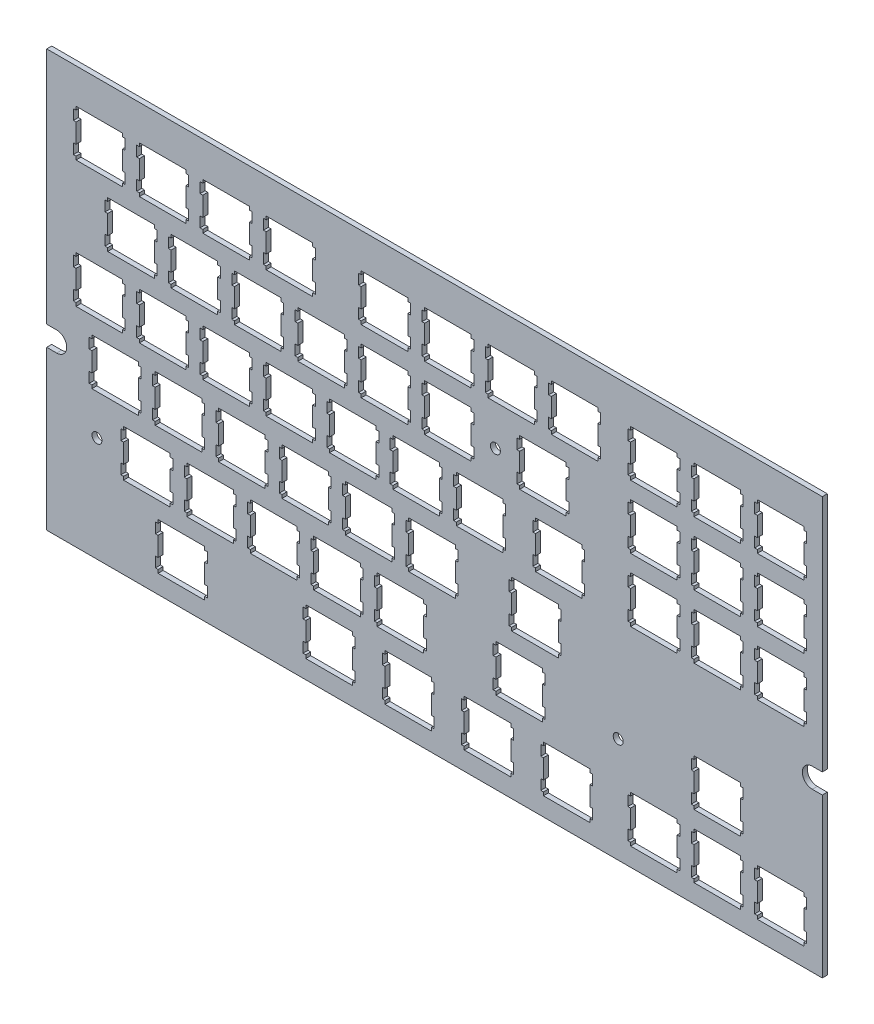
from build123d import *

# Parameters (mm, degrees)
MODEL_R         = 1.5
EXTRUDE_1_DEPTH = 1.5


with BuildPart() as part:
    # Model → 凸台-拉伸1 (new body)
    with BuildSketch(Plane.XY):
        with BuildLine():
            Line((633.499559269, 183.569871673), (633.499559269, 111.895271673))
            Line((633.499559269, 111.895271673), (630.499559269, 111.895271673))
            ThreePointArc((630.499559269, 111.895271673), (627.499559269, 108.895271673), (630.499559269, 105.895271673))
            Line((630.499559269, 105.895271673), (633.499559269, 105.895271673))
            Line((633.499559269, 105.895271673), (633.499559269, 58.269564673))
            Line((633.499559269, 58.269564673), (400.385559269, 58.269564673))
            Line((400.385559269, 58.269564673), (400.385559269, 105.895271673))
            Line((400.385559269, 105.895271673), (403.385559269, 105.895271673))
            ThreePointArc((403.385559269, 105.895271673), (406.385559269, 108.895271673), (403.385559269, 111.895271673))
            Line((403.385559269, 111.895271673), (400.385559269, 111.895271673))
            Line((400.385559269, 111.895271673), (400.385559269, 183.569871673))
            Line((400.385559269, 183.569871673), (633.499559269, 183.569871673))
        make_face()
        with Locations((415.473559269, 89.845571673)):
            Circle(MODEL_R, mode=Mode.SUBTRACT)
        with Locations((535.248446769, 146.995271673)):
            Circle(MODEL_R, mode=Mode.SUBTRACT)
        with Locations((572.157446769, 89.845546673)):
            Circle(MODEL_R, mode=Mode.SUBTRACT)
        Polygon((613.973559269, 77.796371673), (613.973559269, 76.795971673), (613.172559269, 76.795971673), (613.172559269, 73.696671673), (613.973559269, 73.696671673), (613.973559269, 67.895161673), (613.172559269, 67.895161673), (613.172559269, 64.795981673), (613.973559269, 64.795981673), (613.973559269, 63.795511673), (627.973559269, 63.795511673), (627.973559269, 64.795981673), (628.772559269, 64.795981673), (628.772559269, 67.895161673), (627.973559269, 67.895161673), (627.973559269, 73.696671673), (628.772559269, 73.696671673), (628.772559269, 76.795971673), (627.973559269, 76.795971673), (627.973559269, 77.796371673), align=None, mode=Mode.SUBTRACT)
        Polygon((594.923559269, 77.796371673), (594.923559269, 76.795971673), (594.122559269, 76.795971673), (594.122559269, 73.696671673), (594.923559269, 73.696671673), (594.923559269, 67.895161673), (594.122559269, 67.895161673), (594.122559269, 64.795981673), (594.923559269, 64.795981673), (594.923559269, 63.795511673), (608.923559269, 63.795511673), (608.923559269, 64.795981673), (609.722559269, 64.795981673), (609.722559269, 67.895161673), (608.923559269, 67.895161673), (608.923559269, 73.696671673), (609.722559269, 73.696671673), (609.722559269, 76.795971673), (608.923559269, 76.795971673), (608.923559269, 77.796371673), align=None, mode=Mode.SUBTRACT)
        Polygon((575.873559269, 77.796371673), (575.873559269, 76.795971673), (575.072559269, 76.795971673), (575.072559269, 73.696671673), (575.873559269, 73.696671673), (575.873559269, 67.895161673), (575.072559269, 67.895161673), (575.072559269, 64.795981673), (575.873559269, 64.795981673), (575.873559269, 63.795511673), (589.873559269, 63.795511673), (589.873559269, 64.795981673), (590.672559269, 64.795981673), (590.672559269, 67.895161673), (589.873559269, 67.895161673), (589.873559269, 73.696671673), (590.672559269, 73.696671673), (590.672559269, 76.795971673), (589.873559269, 76.795971673), (589.873559269, 77.796371673), align=None, mode=Mode.SUBTRACT)
        Polygon((549.678559269, 77.796371673), (549.678559269, 76.795971673), (548.879559269, 76.795971673), (548.879559269, 73.696671673), (549.678559269, 73.696671673), (549.678559269, 67.895161673), (548.879559269, 67.895161673), (548.879559269, 64.795981673), (549.678559269, 64.795981673), (549.678559269, 63.795511673), (563.679559269, 63.795511673), (563.679559269, 64.795981673), (564.478559269, 64.795981673), (564.478559269, 67.895161673), (563.679559269, 67.895161673), (563.679559269, 73.696671673), (564.478559269, 73.696671673), (564.478559269, 76.795971673), (563.679559269, 76.795971673), (563.679559269, 77.796371673), align=None, mode=Mode.SUBTRACT)
        Polygon((525.867559269, 77.796371673), (525.867559269, 76.795971673), (525.066559269, 76.795971673), (525.066559269, 73.696671673), (525.867559269, 73.696671673), (525.867559269, 67.895161673), (525.066559269, 67.895161673), (525.066559269, 64.795981673), (525.867559269, 64.795981673), (525.867559269, 63.795511673), (539.866559269, 63.795511673), (539.866559269, 64.795981673), (540.667559269, 64.795981673), (540.667559269, 67.895161673), (539.866559269, 67.895161673), (539.866559269, 73.696671673), (540.667559269, 73.696671673), (540.667559269, 76.795971673), (539.866559269, 76.795971673), (539.866559269, 77.796371673), align=None, mode=Mode.SUBTRACT)
        Polygon((502.053559269, 77.796371673), (502.053559269, 76.795971673), (501.254559269, 76.795971673), (501.254559269, 73.696671673), (502.053559269, 73.696671673), (502.053559269, 67.895161673), (501.254559269, 67.895161673), (501.254559269, 64.795981673), (502.053559269, 64.795981673), (502.053559269, 63.795511673), (516.054559269, 63.795511673), (516.054559269, 64.795981673), (516.853559269, 64.795981673), (516.853559269, 67.895161673), (516.054559269, 67.895161673), (516.054559269, 73.696671673), (516.853559269, 73.696671673), (516.853559269, 76.795971673), (516.054559269, 76.795971673), (516.054559269, 77.796371673), align=None, mode=Mode.SUBTRACT)
        Polygon((478.242559269, 77.796371673), (478.242559269, 76.795971673), (477.441559269, 76.795971673), (477.441559269, 73.696671673), (478.242559269, 73.696671673), (478.242559269, 67.895161673), (477.441559269, 67.895161673), (477.441559269, 64.795981673), (478.242559269, 64.795981673), (478.242559269, 63.795511673), (492.241559269, 63.795511673), (492.241559269, 64.795981673), (493.042559269, 64.795981673), (493.042559269, 67.895161673), (492.241559269, 67.895161673), (492.241559269, 73.696671673), (493.042559269, 73.696671673), (493.042559269, 76.795971673), (492.241559269, 76.795971673), (492.241559269, 77.796371673), align=None, mode=Mode.SUBTRACT)
        Polygon((594.923559269, 96.844871673), (594.923559269, 95.844571673), (594.122559269, 95.844571673), (594.122559269, 92.746671673), (594.923559269, 92.746671673), (594.923559269, 86.945171673), (594.122559269, 86.945171673), (594.122559269, 83.844571673), (594.923559269, 83.844571673), (594.923559269, 82.845471673), (608.923559269, 82.845471673), (608.923559269, 83.844571673), (609.722559269, 83.844571673), (609.722559269, 86.945171673), (608.923559269, 86.945171673), (608.923559269, 92.746671673), (609.722559269, 92.746671673), (609.722559269, 95.844571673), (608.923559269, 95.844571673), (608.923559269, 96.844871673), align=None, mode=Mode.SUBTRACT)
        Polygon((499.673559269, 96.844871673), (499.673559269, 95.844571673), (498.872559269, 95.844571673), (498.872559269, 92.746671673), (499.673559269, 92.746671673), (499.673559269, 86.945171673), (498.872559269, 86.945171673), (498.872559269, 83.844571673), (499.673559269, 83.844571673), (499.673559269, 82.845471673), (513.673559269, 82.845471673), (513.673559269, 83.844571673), (514.472559269, 83.844571673), (514.472559269, 86.945171673), (513.673559269, 86.945171673), (513.673559269, 92.746671673), (514.472559269, 92.746671673), (514.472559269, 95.844571673), (513.673559269, 95.844571673), (513.673559269, 96.844871673), align=None, mode=Mode.SUBTRACT)
        Polygon((480.623559269, 96.844871673), (480.623559269, 95.844571673), (479.822559269, 95.844571673), (479.822559269, 92.746671673), (480.623559269, 92.746671673), (480.623559269, 86.945171673), (479.822559269, 86.945171673), (479.822559269, 83.844571673), (480.623559269, 83.844571673), (480.623559269, 82.845471673), (494.623559269, 82.845471673), (494.623559269, 83.844571673), (495.422559269, 83.844571673), (495.422559269, 86.945171673), (494.623559269, 86.945171673), (494.623559269, 92.746671673), (495.422559269, 92.746671673), (495.422559269, 95.844571673), (494.623559269, 95.844571673), (494.623559269, 96.844871673), align=None, mode=Mode.SUBTRACT)
        Polygon((461.573559269, 96.844871673), (461.573559269, 95.844571673), (460.772559269, 95.844571673), (460.772559269, 92.746671673), (461.573559269, 92.746671673), (461.573559269, 86.945171673), (460.772559269, 86.945171673), (460.772559269, 83.844571673), (461.573559269, 83.844571673), (461.573559269, 82.845471673), (475.573559269, 82.845471673), (475.573559269, 83.844571673), (476.372559269, 83.844571673), (476.372559269, 86.945171673), (475.573559269, 86.945171673), (475.573559269, 92.746671673), (476.372559269, 92.746671673), (476.372559269, 95.844571673), (475.573559269, 95.844571673), (475.573559269, 96.844871673), align=None, mode=Mode.SUBTRACT)
        Polygon((442.523559269, 96.844871673), (442.523559269, 95.844571673), (441.722559269, 95.844571673), (441.722559269, 92.746671673), (442.523559269, 92.746671673), (442.523559269, 86.945171673), (441.722559269, 86.945171673), (441.722559269, 83.844571673), (442.523559269, 83.844571673), (442.523559269, 82.845471673), (456.523559269, 82.845471673), (456.523559269, 83.844571673), (457.322559269, 83.844571673), (457.322559269, 86.945171673), (456.523559269, 86.945171673), (456.523559269, 92.746671673), (457.322559269, 92.746671673), (457.322559269, 95.844571673), (456.523559269, 95.844571673), (456.523559269, 96.844871673), align=None, mode=Mode.SUBTRACT)
        Polygon((423.473559269, 96.844871673), (423.473559269, 95.844571673), (422.672559269, 95.844571673), (422.672559269, 92.746671673), (423.473559269, 92.746671673), (423.473559269, 86.945171673), (422.672559269, 86.945171673), (422.672559269, 83.844571673), (423.473559269, 83.844571673), (423.473559269, 82.845471673), (437.473559269, 82.845471673), (437.473559269, 83.844571673), (438.272559269, 83.844571673), (438.272559269, 86.945171673), (437.473559269, 86.945171673), (437.473559269, 92.746671673), (438.272559269, 92.746671673), (438.272559269, 95.844571673), (437.473559269, 95.844571673), (437.473559269, 96.844871673), align=None, mode=Mode.SUBTRACT)
        Polygon((540.153559269, 115.894971673), (540.153559269, 114.894471673), (539.352559269, 114.894471673), (539.352559269, 111.796671673), (540.153559269, 111.796671673), (540.153559269, 105.995271673), (539.352559269, 105.995271673), (539.352559269, 102.894671673), (540.153559269, 102.894671673), (540.153559269, 101.895671673), (554.154559269, 101.895671673), (554.154559269, 102.894671673), (554.953559269, 102.894671673), (554.953559269, 105.995271673), (554.154559269, 105.995271673), (554.154559269, 111.796671673), (554.953559269, 111.796671673), (554.953559269, 114.894471673), (554.154559269, 114.894471673), (554.154559269, 115.894971673), align=None, mode=Mode.SUBTRACT)
        Polygon((509.198559269, 115.894971673), (509.198559269, 114.894471673), (508.397559269, 114.894471673), (508.397559269, 111.796671673), (509.198559269, 111.796671673), (509.198559269, 105.995271673), (508.397559269, 105.995271673), (508.397559269, 102.894671673), (509.198559269, 102.894671673), (509.198559269, 101.895671673), (523.198559269, 101.895671673), (523.198559269, 102.894671673), (523.997559269, 102.894671673), (523.997559269, 105.995271673), (523.198559269, 105.995271673), (523.198559269, 111.796671673), (523.997559269, 111.796671673), (523.997559269, 114.894471673), (523.198559269, 114.894471673), (523.198559269, 115.894971673), align=None, mode=Mode.SUBTRACT)
        Polygon((490.148559269, 115.894971673), (490.148559269, 114.894471673), (489.347559269, 114.894471673), (489.347559269, 111.796671673), (490.148559269, 111.796671673), (490.148559269, 105.995271673), (489.347559269, 105.995271673), (489.347559269, 102.894671673), (490.148559269, 102.894671673), (490.148559269, 101.895671673), (504.148559269, 101.895671673), (504.148559269, 102.894671673), (504.947559269, 102.894671673), (504.947559269, 105.995271673), (504.148559269, 105.995271673), (504.148559269, 111.796671673), (504.947559269, 111.796671673), (504.947559269, 114.894471673), (504.148559269, 114.894471673), (504.148559269, 115.894971673), align=None, mode=Mode.SUBTRACT)
        Polygon((471.098559269, 115.894971673), (471.098559269, 114.894471673), (470.297559269, 114.894471673), (470.297559269, 111.796671673), (471.098559269, 111.796671673), (471.098559269, 105.995271673), (470.297559269, 105.995271673), (470.297559269, 102.894671673), (471.098559269, 102.894671673), (471.098559269, 101.895671673), (485.098559269, 101.895671673), (485.098559269, 102.894671673), (485.897559269, 102.894671673), (485.897559269, 105.995271673), (485.098559269, 105.995271673), (485.098559269, 111.796671673), (485.897559269, 111.796671673), (485.897559269, 114.894471673), (485.098559269, 114.894471673), (485.098559269, 115.894971673), align=None, mode=Mode.SUBTRACT)
        Polygon((452.048559269, 115.894971673), (452.048559269, 114.894471673), (451.247559269, 114.894471673), (451.247559269, 111.796671673), (452.048559269, 111.796671673), (452.048559269, 105.995271673), (451.247559269, 105.995271673), (451.247559269, 102.894671673), (452.048559269, 102.894671673), (452.048559269, 101.895671673), (466.048559269, 101.895671673), (466.048559269, 102.894671673), (466.847559269, 102.894671673), (466.847559269, 105.995271673), (466.048559269, 105.995271673), (466.048559269, 111.796671673), (466.847559269, 111.796671673), (466.847559269, 114.894471673), (466.048559269, 114.894471673), (466.048559269, 115.894971673), align=None, mode=Mode.SUBTRACT)
        Polygon((432.998559269, 115.894971673), (432.998559269, 114.894471673), (432.197559269, 114.894471673), (432.197559269, 111.796671673), (432.998559269, 111.796671673), (432.998559269, 105.995271673), (432.197559269, 105.995271673), (432.197559269, 102.894671673), (432.998559269, 102.894671673), (432.998559269, 101.895671673), (446.998559269, 101.895671673), (446.998559269, 102.894671673), (447.797559269, 102.894671673), (447.797559269, 105.995271673), (446.998559269, 105.995271673), (446.998559269, 111.796671673), (447.797559269, 111.796671673), (447.797559269, 114.894471673), (446.998559269, 114.894471673), (446.998559269, 115.894971673), align=None, mode=Mode.SUBTRACT)
        Polygon((413.948559269, 115.894971673), (413.948559269, 114.894471673), (413.147559269, 114.894471673), (413.147559269, 111.796671673), (413.948559269, 111.796671673), (413.948559269, 105.995271673), (413.147559269, 105.995271673), (413.147559269, 102.894671673), (413.948559269, 102.894671673), (413.948559269, 101.895671673), (427.948559269, 101.895671673), (427.948559269, 102.894671673), (428.747559269, 102.894671673), (428.747559269, 105.995271673), (427.948559269, 105.995271673), (427.948559269, 111.796671673), (428.747559269, 111.796671673), (428.747559269, 114.894471673), (427.948559269, 114.894471673), (427.948559269, 115.894971673), align=None, mode=Mode.SUBTRACT)
        Polygon((613.973559269, 134.944971673), (613.973559269, 133.944471673), (613.172559269, 133.944471673), (613.172559269, 130.845271673), (613.973559269, 130.845271673), (613.973559269, 125.045271673), (613.172559269, 125.045271673), (613.172559269, 121.944671673), (613.973559269, 121.944671673), (613.973559269, 120.945671673), (627.973559269, 120.945671673), (627.973559269, 121.944671673), (628.772559269, 121.944671673), (628.772559269, 125.045271673), (627.973559269, 125.045271673), (627.973559269, 130.845271673), (628.772559269, 130.845271673), (628.772559269, 133.944471673), (627.973559269, 133.944471673), (627.973559269, 134.944971673), align=None, mode=Mode.SUBTRACT)
        Polygon((594.923559269, 134.944971673), (594.923559269, 133.944471673), (594.122559269, 133.944471673), (594.122559269, 130.845271673), (594.923559269, 130.845271673), (594.923559269, 125.045271673), (594.122559269, 125.045271673), (594.122559269, 121.944671673), (594.923559269, 121.944671673), (594.923559269, 120.945671673), (608.923559269, 120.945671673), (608.923559269, 121.944671673), (609.722559269, 121.944671673), (609.722559269, 125.045271673), (608.923559269, 125.045271673), (608.923559269, 130.845271673), (609.722559269, 130.845271673), (609.722559269, 133.944471673), (608.923559269, 133.944471673), (608.923559269, 134.944971673), align=None, mode=Mode.SUBTRACT)
        Polygon((575.873559269, 134.944971673), (575.873559269, 133.944471673), (575.072559269, 133.944471673), (575.072559269, 130.845271673), (575.873559269, 130.845271673), (575.873559269, 125.045271673), (575.072559269, 125.045271673), (575.072559269, 121.944671673), (575.873559269, 121.944671673), (575.873559269, 120.945671673), (589.873559269, 120.945671673), (589.873559269, 121.944671673), (590.672559269, 121.944671673), (590.672559269, 125.045271673), (589.873559269, 125.045271673), (589.873559269, 130.845271673), (590.672559269, 130.845271673), (590.672559269, 133.944471673), (589.873559269, 133.944471673), (589.873559269, 134.944971673), align=None, mode=Mode.SUBTRACT)
        Polygon((547.298559269, 134.944971673), (547.298559269, 133.944471673), (546.497559269, 133.944471673), (546.497559269, 130.845271673), (547.298559269, 130.845271673), (547.298559269, 125.045271673), (546.497559269, 125.045271673), (546.497559269, 121.944671673), (547.298559269, 121.944671673), (547.298559269, 120.945671673), (561.298559269, 120.945671673), (561.298559269, 121.944671673), (562.097559269, 121.944671673), (562.097559269, 125.045271673), (561.298559269, 125.045271673), (561.298559269, 130.845271673), (562.097559269, 130.845271673), (562.097559269, 133.944471673), (561.298559269, 133.944471673), (561.298559269, 134.944971673), align=None, mode=Mode.SUBTRACT)
        Polygon((523.486559269, 134.944971673), (523.486559269, 133.944471673), (522.685559269, 133.944471673), (522.685559269, 130.845271673), (523.486559269, 130.845271673), (523.486559269, 125.045271673), (522.685559269, 125.045271673), (522.685559269, 121.944671673), (523.486559269, 121.944671673), (523.486559269, 120.945671673), (537.485559269, 120.945671673), (537.485559269, 121.944671673), (538.286559269, 121.944671673), (538.286559269, 125.045271673), (537.485559269, 125.045271673), (537.485559269, 130.845271673), (538.286559269, 130.845271673), (538.286559269, 133.944471673), (537.485559269, 133.944471673), (537.485559269, 134.944971673), align=None, mode=Mode.SUBTRACT)
        Polygon((504.436559269, 134.944971673), (504.436559269, 133.944471673), (503.635559269, 133.944471673), (503.635559269, 130.845271673), (504.436559269, 130.845271673), (504.436559269, 125.045271673), (503.635559269, 125.045271673), (503.635559269, 121.944671673), (504.436559269, 121.944671673), (504.436559269, 120.945671673), (518.435559269, 120.945671673), (518.435559269, 121.944671673), (519.236559269, 121.944671673), (519.236559269, 125.045271673), (518.435559269, 125.045271673), (518.435559269, 130.845271673), (519.236559269, 130.845271673), (519.236559269, 133.944471673), (518.435559269, 133.944471673), (518.435559269, 134.944971673), align=None, mode=Mode.SUBTRACT)
        Polygon((485.386559269, 134.944971673), (485.386559269, 133.944471673), (484.585559269, 133.944471673), (484.585559269, 130.845271673), (485.386559269, 130.845271673), (485.386559269, 125.045271673), (484.585559269, 125.045271673), (484.585559269, 121.944671673), (485.386559269, 121.944671673), (485.386559269, 120.945671673), (499.385559269, 120.945671673), (499.385559269, 121.944671673), (500.186559269, 121.944671673), (500.186559269, 125.045271673), (499.385559269, 125.045271673), (499.385559269, 130.845271673), (500.186559269, 130.845271673), (500.186559269, 133.944471673), (499.385559269, 133.944471673), (499.385559269, 134.944971673), align=None, mode=Mode.SUBTRACT)
        Polygon((466.336559269, 134.944971673), (466.336559269, 133.944471673), (465.535559269, 133.944471673), (465.535559269, 130.845271673), (466.336559269, 130.845271673), (466.336559269, 125.045271673), (465.535559269, 125.045271673), (465.535559269, 121.944671673), (466.336559269, 121.944671673), (466.336559269, 120.945671673), (480.335559269, 120.945671673), (480.335559269, 121.944671673), (481.136559269, 121.944671673), (481.136559269, 125.045271673), (480.335559269, 125.045271673), (480.335559269, 130.845271673), (481.136559269, 130.845271673), (481.136559269, 133.944471673), (480.335559269, 133.944471673), (480.335559269, 134.944971673), align=None, mode=Mode.SUBTRACT)
        Polygon((447.286559269, 134.944971673), (447.286559269, 133.944471673), (446.485559269, 133.944471673), (446.485559269, 130.845271673), (447.286559269, 130.845271673), (447.286559269, 125.045271673), (446.485559269, 125.045271673), (446.485559269, 121.944671673), (447.286559269, 121.944671673), (447.286559269, 120.945671673), (461.285559269, 120.945671673), (461.285559269, 121.944671673), (462.086559269, 121.944671673), (462.086559269, 125.045271673), (461.285559269, 125.045271673), (461.285559269, 130.845271673), (462.086559269, 130.845271673), (462.086559269, 133.944471673), (461.285559269, 133.944471673), (461.285559269, 134.944971673), align=None, mode=Mode.SUBTRACT)
        Polygon((428.236559269, 134.944971673), (428.236559269, 133.944471673), (427.435559269, 133.944471673), (427.435559269, 130.845271673), (428.236559269, 130.845271673), (428.236559269, 125.045271673), (427.435559269, 125.045271673), (427.435559269, 121.944671673), (428.236559269, 121.944671673), (428.236559269, 120.945671673), (442.235559269, 120.945671673), (442.235559269, 121.944671673), (443.036559269, 121.944671673), (443.036559269, 125.045271673), (442.235559269, 125.045271673), (442.235559269, 130.845271673), (443.036559269, 130.845271673), (443.036559269, 133.944471673), (442.235559269, 133.944471673), (442.235559269, 134.944971673), align=None, mode=Mode.SUBTRACT)
        Polygon((409.186559269, 134.944971673), (409.186559269, 133.944471673), (408.385559269, 133.944471673), (408.385559269, 130.845271673), (409.186559269, 130.845271673), (409.186559269, 125.045271673), (408.385559269, 125.045271673), (408.385559269, 121.944671673), (409.186559269, 121.944671673), (409.186559269, 120.945671673), (423.185559269, 120.945671673), (423.185559269, 121.944671673), (423.986559269, 121.944671673), (423.986559269, 125.045271673), (423.185559269, 125.045271673), (423.185559269, 130.845271673), (423.986559269, 130.845271673), (423.986559269, 133.944471673), (423.185559269, 133.944471673), (423.185559269, 134.944971673), align=None, mode=Mode.SUBTRACT)
        Polygon((613.973559269, 153.994971673), (613.973559269, 152.994471673), (613.172559269, 152.994471673), (613.172559269, 149.895271673), (613.973559269, 149.895271673), (613.973559269, 144.095271673), (613.172559269, 144.095271673), (613.172559269, 140.994671673), (613.973559269, 140.994671673), (613.973559269, 139.995671673), (627.973559269, 139.995671673), (627.973559269, 140.994671673), (628.772559269, 140.994671673), (628.772559269, 144.095271673), (627.973559269, 144.095271673), (627.973559269, 149.895271673), (628.772559269, 149.895271673), (628.772559269, 152.994471673), (627.973559269, 152.994471673), (627.973559269, 153.994971673), align=None, mode=Mode.SUBTRACT)
        Polygon((594.923559269, 153.994971673), (594.923559269, 152.994471673), (594.122559269, 152.994471673), (594.122559269, 149.895271673), (594.923559269, 149.895271673), (594.923559269, 144.095271673), (594.122559269, 144.095271673), (594.122559269, 140.994671673), (594.923559269, 140.994671673), (594.923559269, 139.995671673), (608.923559269, 139.995671673), (608.923559269, 140.994671673), (609.722559269, 140.994671673), (609.722559269, 144.095271673), (608.923559269, 144.095271673), (608.923559269, 149.895271673), (609.722559269, 149.895271673), (609.722559269, 152.994471673), (608.923559269, 152.994471673), (608.923559269, 153.994971673), align=None, mode=Mode.SUBTRACT)
        Polygon((575.873559269, 153.994971673), (575.873559269, 152.994471673), (575.072559269, 152.994471673), (575.072559269, 149.895271673), (575.873559269, 149.895271673), (575.873559269, 144.095271673), (575.072559269, 144.095271673), (575.072559269, 140.994671673), (575.873559269, 140.994671673), (575.873559269, 139.995671673), (589.873559269, 139.995671673), (589.873559269, 140.994671673), (590.672559269, 140.994671673), (590.672559269, 144.095271673), (589.873559269, 144.095271673), (589.873559269, 149.895271673), (590.672559269, 149.895271673), (590.672559269, 152.994471673), (589.873559269, 152.994471673), (589.873559269, 153.994971673), align=None, mode=Mode.SUBTRACT)
        Polygon((513.961559269, 153.994971673), (513.961559269, 152.994471673), (513.160559269, 152.994471673), (513.160559269, 149.895271673), (513.961559269, 149.895271673), (513.961559269, 144.095271673), (513.160559269, 144.095271673), (513.160559269, 140.994671673), (513.961559269, 140.994671673), (513.961559269, 139.995671673), (527.960559269, 139.995671673), (527.960559269, 140.994671673), (528.761559269, 140.994671673), (528.761559269, 144.095271673), (527.960559269, 144.095271673), (527.960559269, 149.895271673), (528.761559269, 149.895271673), (528.761559269, 152.994471673), (527.960559269, 152.994471673), (527.960559269, 153.994971673), align=None, mode=Mode.SUBTRACT)
        Polygon((494.911559269, 153.994971673), (494.911559269, 152.994471673), (494.110559269, 152.994471673), (494.110559269, 149.895271673), (494.911559269, 149.895271673), (494.911559269, 144.095271673), (494.110559269, 144.095271673), (494.110559269, 140.994671673), (494.911559269, 140.994671673), (494.911559269, 139.995671673), (508.910559269, 139.995671673), (508.910559269, 140.994671673), (509.711559269, 140.994671673), (509.711559269, 144.095271673), (508.910559269, 144.095271673), (508.910559269, 149.895271673), (509.711559269, 149.895271673), (509.711559269, 152.994471673), (508.910559269, 152.994471673), (508.910559269, 153.994971673), align=None, mode=Mode.SUBTRACT)
        Polygon((475.861559269, 153.994971673), (475.861559269, 152.994471673), (475.060559269, 152.994471673), (475.060559269, 149.895271673), (475.861559269, 149.895271673), (475.861559269, 144.095271673), (475.060559269, 144.095271673), (475.060559269, 140.994671673), (475.861559269, 140.994671673), (475.861559269, 139.995671673), (489.860559269, 139.995671673), (489.860559269, 140.994671673), (490.661559269, 140.994671673), (490.661559269, 144.095271673), (489.860559269, 144.095271673), (489.860559269, 149.895271673), (490.661559269, 149.895271673), (490.661559269, 152.994471673), (489.860559269, 152.994471673), (489.860559269, 153.994971673), align=None, mode=Mode.SUBTRACT)
        Polygon((456.811559269, 153.994971673), (456.811559269, 152.994471673), (456.010559269, 152.994471673), (456.010559269, 149.895271673), (456.811559269, 149.895271673), (456.811559269, 144.095271673), (456.010559269, 144.095271673), (456.010559269, 140.994671673), (456.811559269, 140.994671673), (456.811559269, 139.995671673), (470.810559269, 139.995671673), (470.810559269, 140.994671673), (471.611559269, 140.994671673), (471.611559269, 144.095271673), (470.810559269, 144.095271673), (470.810559269, 149.895271673), (471.611559269, 149.895271673), (471.611559269, 152.994471673), (470.810559269, 152.994471673), (470.810559269, 153.994971673), align=None, mode=Mode.SUBTRACT)
        Polygon((437.761559269, 153.994971673), (437.761559269, 152.994471673), (436.960559269, 152.994471673), (436.960559269, 149.895271673), (437.761559269, 149.895271673), (437.761559269, 144.095271673), (436.960559269, 144.095271673), (436.960559269, 140.994671673), (437.761559269, 140.994671673), (437.761559269, 139.995671673), (451.760559269, 139.995671673), (451.760559269, 140.994671673), (452.561559269, 140.994671673), (452.561559269, 144.095271673), (451.760559269, 144.095271673), (451.760559269, 149.895271673), (452.561559269, 149.895271673), (452.561559269, 152.994471673), (451.760559269, 152.994471673), (451.760559269, 153.994971673), align=None, mode=Mode.SUBTRACT)
        Polygon((418.711559269, 153.994971673), (418.711559269, 152.994471673), (417.910559269, 152.994471673), (417.910559269, 149.895271673), (418.711559269, 149.895271673), (418.711559269, 144.095271673), (417.910559269, 144.095271673), (417.910559269, 140.994671673), (418.711559269, 140.994671673), (418.711559269, 139.995671673), (432.710559269, 139.995671673), (432.710559269, 140.994671673), (433.511559269, 140.994671673), (433.511559269, 144.095271673), (432.710559269, 144.095271673), (432.710559269, 149.895271673), (433.511559269, 149.895271673), (433.511559269, 152.994471673), (432.710559269, 152.994471673), (432.710559269, 153.994971673), align=None, mode=Mode.SUBTRACT)
        Polygon((613.973559269, 173.044871673), (613.973559269, 172.044871673), (613.172559269, 172.044871673), (613.172559269, 168.944871673), (613.973559269, 168.944871673), (613.973559269, 163.144871673), (613.172559269, 163.144871673), (613.172559269, 160.044671673), (613.973559269, 160.044671673), (613.973559269, 159.045671673), (627.973559269, 159.045671673), (627.973559269, 160.044671673), (628.772559269, 160.044671673), (628.772559269, 163.144871673), (627.973559269, 163.144871673), (627.973559269, 168.944871673), (628.772559269, 168.944871673), (628.772559269, 172.044871673), (627.973559269, 172.044871673), (627.973559269, 173.044871673), align=None, mode=Mode.SUBTRACT)
        Polygon((594.923559269, 173.044871673), (594.923559269, 172.044871673), (594.122559269, 172.044871673), (594.122559269, 168.944871673), (594.923559269, 168.944871673), (594.923559269, 163.144871673), (594.122559269, 163.144871673), (594.122559269, 160.044671673), (594.923559269, 160.044671673), (594.923559269, 159.045671673), (608.923559269, 159.045671673), (608.923559269, 160.044671673), (609.722559269, 160.044671673), (609.722559269, 163.144871673), (608.923559269, 163.144871673), (608.923559269, 168.944871673), (609.722559269, 168.944871673), (609.722559269, 172.044871673), (608.923559269, 172.044871673), (608.923559269, 173.044871673), align=None, mode=Mode.SUBTRACT)
        Polygon((575.873559269, 173.044871673), (575.873559269, 172.044871673), (575.072559269, 172.044871673), (575.072559269, 168.944871673), (575.873559269, 168.944871673), (575.873559269, 163.144871673), (575.072559269, 163.144871673), (575.072559269, 160.044671673), (575.873559269, 160.044671673), (575.873559269, 159.045671673), (589.873559269, 159.045671673), (589.873559269, 160.044671673), (590.672559269, 160.044671673), (590.672559269, 163.144871673), (589.873559269, 163.144871673), (589.873559269, 168.944871673), (590.672559269, 168.944871673), (590.672559269, 172.044871673), (589.873559269, 172.044871673), (589.873559269, 173.044871673), align=None, mode=Mode.SUBTRACT)
        Polygon((552.061559269, 173.044871673), (552.061559269, 172.044871673), (551.260559269, 172.044871673), (551.260559269, 168.944871673), (552.061559269, 168.944871673), (552.061559269, 163.144871673), (551.260559269, 163.144871673), (551.260559269, 160.044671673), (552.061559269, 160.044671673), (552.061559269, 159.045671673), (566.060559269, 159.045671673), (566.060559269, 160.044671673), (566.861559269, 160.044671673), (566.861559269, 163.144871673), (566.060559269, 163.144871673), (566.060559269, 168.944871673), (566.861559269, 168.944871673), (566.861559269, 172.044871673), (566.060559269, 172.044871673), (566.060559269, 173.044871673), align=None, mode=Mode.SUBTRACT)
        Polygon((533.011559269, 173.044871673), (533.011559269, 172.044871673), (532.210559269, 172.044871673), (532.210559269, 168.944871673), (533.011559269, 168.944871673), (533.011559269, 163.144871673), (532.210559269, 163.144871673), (532.210559269, 160.044671673), (533.011559269, 160.044671673), (533.011559269, 159.045671673), (547.010559269, 159.045671673), (547.010559269, 160.044671673), (547.811559269, 160.044671673), (547.811559269, 163.144871673), (547.010559269, 163.144871673), (547.010559269, 168.944871673), (547.811559269, 168.944871673), (547.811559269, 172.044871673), (547.010559269, 172.044871673), (547.010559269, 173.044871673), align=None, mode=Mode.SUBTRACT)
        Polygon((513.961559269, 173.044871673), (513.961559269, 172.044871673), (513.160559269, 172.044871673), (513.160559269, 168.944871673), (513.961559269, 168.944871673), (513.961559269, 163.144871673), (513.160559269, 163.144871673), (513.160559269, 160.044671673), (513.961559269, 160.044671673), (513.961559269, 159.045671673), (527.960559269, 159.045671673), (527.960559269, 160.044671673), (528.761559269, 160.044671673), (528.761559269, 163.144871673), (527.960559269, 163.144871673), (527.960559269, 168.944871673), (528.761559269, 168.944871673), (528.761559269, 172.044871673), (527.960559269, 172.044871673), (527.960559269, 173.044871673), align=None, mode=Mode.SUBTRACT)
        Polygon((494.911559269, 173.044871673), (494.911559269, 172.044871673), (494.110559269, 172.044871673), (494.110559269, 168.944871673), (494.911559269, 168.944871673), (494.911559269, 163.144871673), (494.110559269, 163.144871673), (494.110559269, 160.044671673), (494.911559269, 160.044671673), (494.911559269, 159.045671673), (508.910559269, 159.045671673), (508.910559269, 160.044671673), (509.711559269, 160.044671673), (509.711559269, 163.144871673), (508.910559269, 163.144871673), (508.910559269, 168.944871673), (509.711559269, 168.944871673), (509.711559269, 172.044871673), (508.910559269, 172.044871673), (508.910559269, 173.044871673), align=None, mode=Mode.SUBTRACT)
        Polygon((466.336559269, 173.044871673), (466.336559269, 172.044871673), (465.535559269, 172.044871673), (465.535559269, 168.944871673), (466.336559269, 168.944871673), (466.336559269, 163.144871673), (465.535559269, 163.144871673), (465.535559269, 160.044671673), (466.336559269, 160.044671673), (466.336559269, 159.045671673), (480.335559269, 159.045671673), (480.335559269, 160.044671673), (481.136559269, 160.044671673), (481.136559269, 163.144871673), (480.335559269, 163.144871673), (480.335559269, 168.944871673), (481.136559269, 168.944871673), (481.136559269, 172.044871673), (480.335559269, 172.044871673), (480.335559269, 173.044871673), align=None, mode=Mode.SUBTRACT)
        Polygon((447.286559269, 173.044871673), (447.286559269, 172.044871673), (446.485559269, 172.044871673), (446.485559269, 168.944871673), (447.286559269, 168.944871673), (447.286559269, 163.144871673), (446.485559269, 163.144871673), (446.485559269, 160.044671673), (447.286559269, 160.044671673), (447.286559269, 159.045671673), (461.285559269, 159.045671673), (461.285559269, 160.044671673), (462.086559269, 160.044671673), (462.086559269, 163.144871673), (461.285559269, 163.144871673), (461.285559269, 168.944871673), (462.086559269, 168.944871673), (462.086559269, 172.044871673), (461.285559269, 172.044871673), (461.285559269, 173.044871673), align=None, mode=Mode.SUBTRACT)
        Polygon((428.236559269, 173.044871673), (428.236559269, 172.044871673), (427.435559269, 172.044871673), (427.435559269, 168.944871673), (428.236559269, 168.944871673), (428.236559269, 163.144871673), (427.435559269, 163.144871673), (427.435559269, 160.044671673), (428.236559269, 160.044671673), (428.236559269, 159.045671673), (442.235559269, 159.045671673), (442.235559269, 160.044671673), (443.036559269, 160.044671673), (443.036559269, 163.144871673), (442.235559269, 163.144871673), (442.235559269, 168.944871673), (443.036559269, 168.944871673), (443.036559269, 172.044871673), (442.235559269, 172.044871673), (442.235559269, 173.044871673), align=None, mode=Mode.SUBTRACT)
        Polygon((409.186559269, 173.044871673), (409.186559269, 172.044871673), (408.385559269, 172.044871673), (408.385559269, 168.944871673), (409.186559269, 168.944871673), (409.186559269, 163.144871673), (408.385559269, 163.144871673), (408.385559269, 160.044671673), (409.186559269, 160.044671673), (409.186559269, 159.045671673), (423.185559269, 159.045671673), (423.185559269, 160.044671673), (423.986559269, 160.044671673), (423.986559269, 163.144871673), (423.185559269, 163.144871673), (423.185559269, 168.944871673), (423.986559269, 168.944871673), (423.986559269, 172.044871673), (423.185559269, 172.044871673), (423.185559269, 173.044871673), align=None, mode=Mode.SUBTRACT)
        Polygon((542.536059269, 153.994971673), (542.536059269, 152.994471673), (541.735059269, 152.994471673), (541.735059269, 149.895271673), (542.536059269, 149.895271673), (542.536059269, 144.095271673), (541.735059269, 144.095271673), (541.735059269, 140.994671673), (542.536059269, 140.994671673), (542.536059269, 139.995671673), (556.536059269, 139.995671673), (556.536059269, 140.994671673), (557.335059269, 140.994671673), (557.335059269, 144.095271673), (556.536059269, 144.095271673), (556.536059269, 149.895271673), (557.335059269, 149.895271673), (557.335059269, 152.994471673), (556.536059269, 152.994471673), (556.536059269, 153.994971673), align=None, mode=Mode.SUBTRACT)
        Polygon((433.859534269, 77.796401673), (433.859534269, 76.796001673), (433.060334269, 76.796001673), (433.060334269, 73.696701673), (433.859534269, 73.696701673), (433.859534269, 67.895191673), (433.060334269, 67.895191673), (433.060334269, 64.796011673), (433.859534269, 64.796011673), (433.859534269, 63.795541673), (447.860334269, 63.795541673), (447.860334269, 64.796011673), (448.659734269, 64.796011673), (448.659734269, 67.895191673), (447.860334269, 67.895191673), (447.860334269, 73.696701673), (448.659734269, 73.696701673), (448.659734269, 76.796001673), (447.860334269, 76.796001673), (447.860334269, 77.796401673), align=None, mode=Mode.SUBTRACT)
        Polygon((535.390534269, 96.845626673), (535.390534269, 95.845226673), (534.591334269, 95.845226673), (534.591334269, 92.745926673), (535.390534269, 92.745926673), (535.390534269, 86.944416673), (534.591334269, 86.944416673), (534.591334269, 83.845236673), (535.390534269, 83.845236673), (535.390534269, 82.844766673), (549.391334269, 82.844766673), (549.391334269, 83.845236673), (550.190734269, 83.845236673), (550.190734269, 86.944416673), (549.391334269, 86.944416673), (549.391334269, 92.745926673), (550.190734269, 92.745926673), (550.190734269, 95.845226673), (549.391334269, 95.845226673), (549.391334269, 96.845626673), align=None, mode=Mode.SUBTRACT)
    extrude(amount=EXTRUDE_1_DEPTH)


solid = part.part
